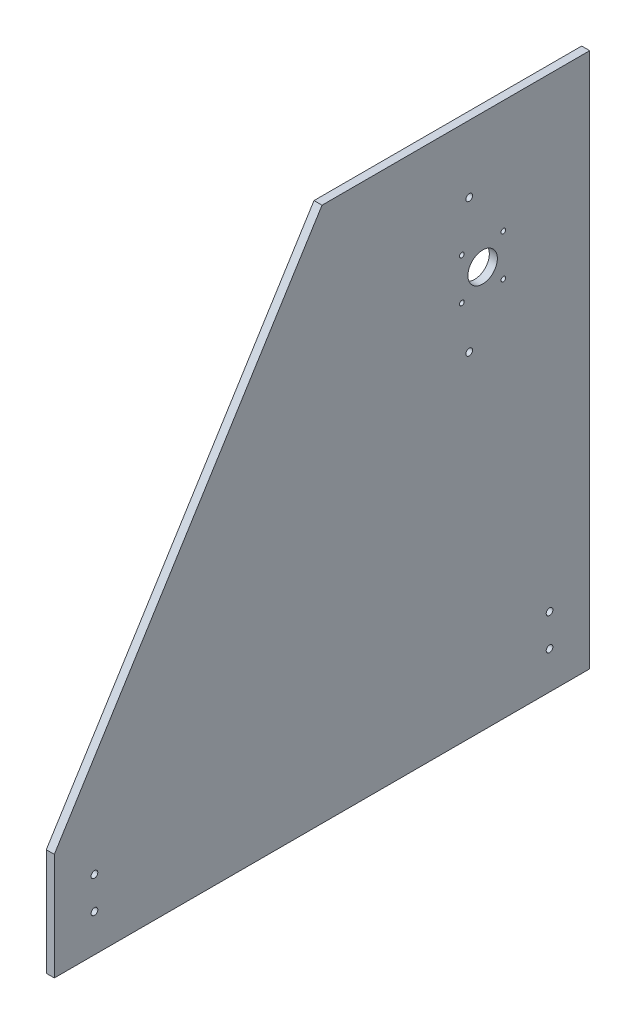
from build123d import *

# Parameters (mm, degrees)
SKETCH1_R           = 2.5
SKETCH1_R_2         = 11
SKETCH1_R_3         = 1.75
BOSS_EXTRUDE1_DEPTH = 6


with BuildPart() as part:
    # Sketch1 → Boss-Extrude1 (new body)
    with BuildSketch(Plane(origin=(0, 0, 0), x_dir=(0, 0, -1), z_dir=(1, 0, 0))):
        Polygon((0, 0), (400, 0), (400, 400), (200, 400), (0, 80), align=None)
        with Locations((30, 52)):
            Circle(SKETCH1_R, mode=Mode.SUBTRACT)
        with Locations((30, 28)):
            Circle(SKETCH1_R, mode=Mode.SUBTRACT)
        with Locations((370, 28)):
            Circle(SKETCH1_R, mode=Mode.SUBTRACT)
        with Locations((370, 52)):
            Circle(SKETCH1_R, mode=Mode.SUBTRACT)
        with Locations((310, 350)):
            Circle(SKETCH1_R, mode=Mode.SUBTRACT)
        with Locations((310, 250)):
            Circle(SKETCH1_R, mode=Mode.SUBTRACT)
        with Locations((320, 300)):
            Circle(SKETCH1_R_2, mode=Mode.SUBTRACT)
        with Locations((335.5, 315.5)):
            Circle(SKETCH1_R_3, mode=Mode.SUBTRACT)
        with Locations((304.5, 315.5)):
            Circle(SKETCH1_R_3, mode=Mode.SUBTRACT)
        with Locations((304.5, 284.5)):
            Circle(SKETCH1_R_3, mode=Mode.SUBTRACT)
        with Locations((335.5, 284.5)):
            Circle(SKETCH1_R_3, mode=Mode.SUBTRACT)
    extrude(amount=BOSS_EXTRUDE1_DEPTH)


solid = part.part
